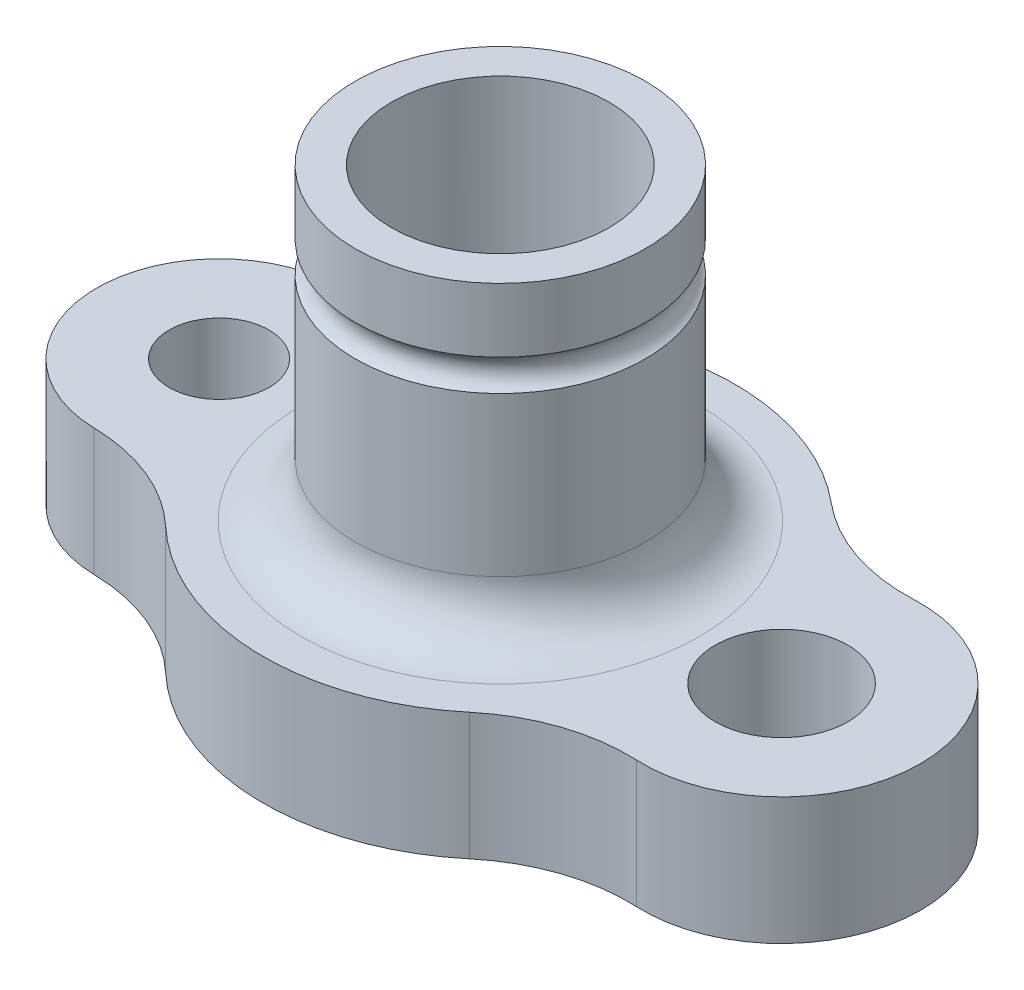
from build123d import *

# Parameters (mm, degrees)
SKETCH1_R           = 7
SKETCH1_R_2         = 2.75
SKETCH1_R_3         = 3.659852489
BOSS_EXTRUDE1_DEPTH = 7
SKETCH2_R           = 8
SKETCH2_R_2         = 6
BOSS_EXTRUDE2_DEPTH = 17
FILLET1_R           = 3
FILLET2_R           = 3
SKETCH3_R           = 1


with BuildPart() as part:
    # Sketch1 → Boss-Extrude1 (new body)
    with BuildSketch(Plane(origin=(0, 0, 0), x_dir=(1, 0, 0), z_dir=(0, 1, 0))):
        with BuildLine():
            ThreePointArc((-15.634333704, 6.748663161), (-22.25, 0), (-15.634333704, -6.748663161))
            ThreePointArc((-15.634333704, -6.748663161), (-12.054001616, -7.488359295), (-8.978814065, -9.465516285))
            ThreePointArc((-8.978814065, -9.465516285), (-0.448762307, -12.99442036), (8.273320847, -9.971141939))
            ThreePointArc((8.273320847, -9.971141939), (11.493139678, -8.165901558), (15.148520579, -7.651784261))
            ThreePointArc((15.148520579, -7.651784261), (23.159852489, 0), (15.148520579, 7.651784261))
            ThreePointArc((15.148520579, 7.651784261), (11.493139678, 8.165901558), (8.273320847, 9.971141939))
            ThreePointArc((8.273320847, 9.971141939), (-0.448762307, 12.99442036), (-8.978814065, 9.465516285))
            ThreePointArc((-8.978814065, 9.465516285), (-12.054001616, 7.488359295), (-15.634333704, 6.748663161))
        make_face()
        with Locations(Location((0, 0, 0), (0, 0, 270))):
            Circle(SKETCH1_R, mode=Mode.SUBTRACT)
        with Locations(Location((-15.5, 0, 0), (0, 0, 270))):
            Circle(SKETCH1_R_2, mode=Mode.SUBTRACT)
        with Locations(Location((15.5, 0, 0), (0, 0, 270))):
            Circle(SKETCH1_R_3, mode=Mode.SUBTRACT)
    extrude(amount=BOSS_EXTRUDE1_DEPTH)

    # Sketch2 → Boss-Extrude2 (add)
    with BuildSketch(Plane(origin=(0, 7, 0), x_dir=(1, 0, 0), z_dir=(0, 1, 0))):
        with Locations(Location((0, 0, 0), (0, 0, 270))):
            Circle(SKETCH2_R)
        with Locations(Location((0, 0, 0), (0, 0, 270))):
            Circle(SKETCH2_R_2, mode=Mode.SUBTRACT)
    extrude(amount=BOSS_EXTRUDE2_DEPTH)

    # Fillet1
    # the kernel refuses this fillet: 3 mm, written as the material it adds along each edge
    with BuildSketch(Plane(origin=(0, 7, 0), x_dir=(0, 0, 1), z_dir=(-1, 0, 0))) as fillet1_piece_1:
        with BuildLine():
            CenterArc((4, -2.236067977), FILLET1_R, 0, 48.189685104)
            Line((6, 0), (6.04, 0.04472136))
            ThreePointArc((6.04, 0.04472136), (6.5, 0.06), (7, 0.06))
            Line((7, 0.06), (7.06, 0))
            Line((7.06, 0), (7.06, -2.236067977))
            Line((7.06, -2.236067977), (7, -2.236067977))
        make_face()
    revolve(axis=Axis((0, 7, 0), (0, 1, 0)))
    with BuildSketch(Plane(origin=(0, 7, 0), x_dir=(0, 0, 1), z_dir=(-1, 0, 0))) as fillet1_piece_2:
        with BuildLine():
            CenterArc((8 + FILLET1_R, FILLET1_R), FILLET1_R, 180, 90)
            Line((8, FILLET1_R), (8 - FILLET1_R * 0.02, FILLET1_R))
            Line((8 - FILLET1_R * 0.02, FILLET1_R), (8 - FILLET1_R * 0.02, -FILLET1_R * 0.02))
            Line((8 - FILLET1_R * 0.02, -FILLET1_R * 0.02), (8 + FILLET1_R, -FILLET1_R * 0.02))
            Line((8 + FILLET1_R, -FILLET1_R * 0.02), (8 + FILLET1_R, 0))
        make_face()
    revolve(axis=Axis((0, 7, 0), (0, 1, 0)))

    # Fillet2
    fillet2_edges = [part.edges().sort_by_distance(p)[0] for p in [
        (0, 7, -6),
    ]]
    fillet(fillet2_edges, radius=FILLET2_R)


with BuildPart() as body_2:
    # Sketch3 → Revolve1 (revolve)
    with BuildSketch(Plane(origin=(0, 0, 0), x_dir=(0, 0, -1), z_dir=(1, 0, 0))):
        with Locations((8.5, 19.608844607)):
            Circle(SKETCH3_R)
    revolve(axis=Axis((0, 0, 0), (0, 1, 0)))


with BuildPart() as part_1:
    add(part.part)

    # Intersect1: read off the stored shape, not the designer's step
    # Intersect1: cut body 2
    add(body_2.part, mode=Mode.SUBTRACT)


solid = part_1.part
